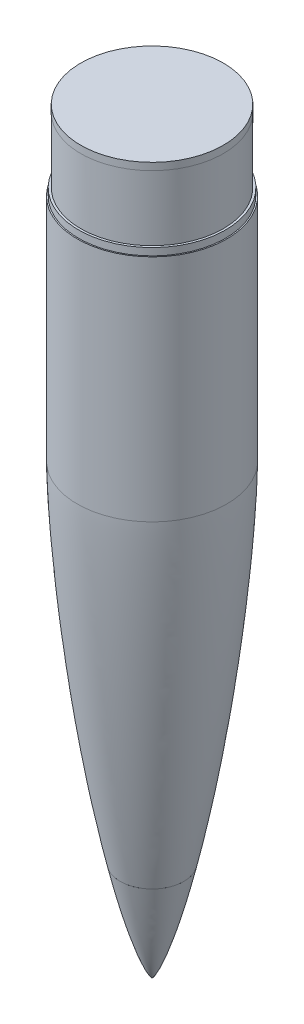
from build123d import *

# Parameters (mm, degrees)
SHELL3_T              = -3
REVOLVE10_START       = 309.892338598
REVOLVE10_OUTLINE_R   = 51.703475653
REVOLVE10_OUTLINE_R_2 = 49.33
REVOLVE10_DEPTH       = 158.88
SKETCH19_W            = 5
SKETCH19_H            = 49.34319438
SKETCH19_W_2          = 44.469592032
SKETCH19_H_2          = 5


# Read off the part's stored shape, not the designer's step: Revolve6, Revolve10, Revolve12
with BuildPart() as part:
    # Sketch1 → Revolve2 (revolve)
    with BuildSketch(Plane.YZ):
        with BuildLine():
            Line((68.892338598, 22.03669608), (68.892338598, 0))
            Line((68.892338598, 0), (309.892338598, 0))
            Line((309.892338598, 0), (309.892338598, 51.703475653))
            add(Edge.make_bspline(
                [(68.892338598, 22.036696078), (70.96416969, 22.497415108), (77.876502823, 24.010245465), (89.654701691, 26.457883592), (106.334645431, 29.655747436), (125.853639326, 33.065816617), (145.420783183, 36.187092783), (165.028645768, 39.040695578), (184.671859186, 41.639540014), (201.886997195, 43.696336538), (216.660371523, 45.304357577), (228.982426726, 46.53899565), (238.846350049, 47.46204834), (248.71628369, 48.318358048), (258.592017893, 49.104905531), (267.23821101, 49.728348294), (274.652658501, 50.212563982), (280.833617265, 50.579677684), (285.779727539, 50.849965544), (290.549374247, 51.086062909), (295.142398502, 51.288398084), (299.028855922, 51.436861373), (302.20824599, 51.540979), (304.858146787, 51.614171697), (306.713295392, 51.656552534), (308.236897063, 51.68463502), (309.230482405, 51.697083627), (309.693947311, 51.702090464), (309.892338598, 51.703475653)],
                knots=[0.230016032, 0.230016032, 0.230016032, 0.230016032, 0.230016032, 0.256872057, 0.319550184, 0.382228361, 0.444906455, 0.507584556, 0.570262684, 0.632940739, 0.695618764, 0.726957916, 0.758297067, 0.78963614, 0.820975213, 0.852314205, 0.883653198, 0.899322747, 0.914992297, 0.930661847, 0.946331397, 0.959748547, 0.973165698, 0.979874274, 0.986582849, 0.993291425, 0.996645712, 0.999156098, 0.999156098, 0.999156098, 0.999156098, 0.999156098], degree=4))
        make_face()
    revolve(axis=Axis((0, 0, 0), (0, 1, 0)))

    # Shell3
    shell3_openings = [part.faces().sort_by_distance(p)[0] for p in [
        (0, 309.892338598, 0),
        (0, 68.892338598, 0),
    ]]
    offset(amount=SHELL3_T, openings=shell3_openings, kind=Kind.INTERSECTION)

    # Sketch4 → Revolve5 (revolve)
    with BuildSketch(Plane(origin=(0, 0, 0), x_dir=(0, 1, 0), z_dir=(0, 0, 1)), mode=Mode.PRIVATE) as revolve5_sk:
        with BuildLine():
            add(Edge.make_bspline(
                [(118.892338598, 31.821069636), (118.193769239, 31.700420222), (112.61470459, 30.732647056), (102.165796478, 28.856499456), (89.654701691, 26.457883592), (77.876502823, 24.010245465), (70.96416969, 22.497415108), (68.892338598, 22.036696078)],
                knots=[0.607957601, 0.607957601, 0.607957601, 0.607957601, 0.607957601, 0.616927738, 0.679605914, 0.742284041, 0.769140067, 0.769140067, 0.769140067, 0.769140067, 0.769140067], degree=4))
            Line((68.892338598, 22.036696078), (68.892338598, 5.2))
            Line((68.892338598, 5.2), (83.892338598, 5.2))
            Line((83.892338598, 5.2), (118.892338598, 31.821069636))
        make_face()
    revolve(revolve5_sk.sketch.rotate(Axis((0, 0, 0), (0, 1, 0)), 90), axis=Axis((0, 0, 0), (0, 1, 0)))


with BuildPart() as body_2:
    # Sketch1<3> → Revolve3 (revolve)
    with BuildSketch(Plane.YZ):
        with BuildLine():
            add(Edge.make_bspline(
                [(0, 0), (0.001839143, 0.008888702), (0.007057294, 0.026188991), (0.022910311, 0.058976608), (0.056830094, 0.115635308), (0.108445486, 0.185649019), (0.191042047, 0.282917967), (0.316816673, 0.41262197), (0.508591814, 0.58839974), (0.830391435, 0.850120888), (1.372217083, 1.239564322), (2.325596475, 1.842085487), (4.024603962, 2.778864407), (6.971087135, 4.18782688), (11.987547002, 6.266678684), (20.509596689, 9.321209841), (33.015491366, 13.174452663), (46.931080328, 16.901757504), (58.537509164, 19.698426631), (66.128829141, 21.422166545), (68.892338598, 22.036696078)],
                knots=[0, 0, 0, 0, 0, 0.000114554, 0.000229109, 0.000458218, 0.000835627, 0.001213037, 0.001843102, 0.00274275, 0.0041256, 0.006458657, 0.010281417, 0.017005475, 0.028661401, 0.04776443, 0.078962988, 0.131516009, 0.194194154, 0.230016032, 0.230016032, 0.230016032, 0.230016032, 0.230016032], degree=4))
            Line((0, 0), (68.892338598, 0))
            Line((68.892338598, 0), (68.892338598, 22.03669608))
        make_face()
    revolve(axis=Axis((0, 0, 0), (0, 1, 0)))

    # Sketch6 → M10x1.5 Tapped Hole1 (revolve, cut)
    with BuildSketch(Plane(origin=(0, 68.892338598, 0), x_dir=(0, 0, 1), z_dir=(1, 0, 0))):
        Polygon((0, 0), (0, 27.053657631), (4.25, 24.5), (4.25, 0.775), (5.025, 0), align=None)
    revolve(axis=Axis((0, 75.242338598, 0), (0, -1, 0)), mode=Mode.SUBTRACT)


with BuildPart() as body_3:
    # Revolve6 outline → Revolve6 (revolve)
    with BuildSketch(Plane.XY):
        Polygon((50.68012246, 291.115771676), (49.33, 291.115771676), (49.33, 289.615771676), (50.854, 289.615771676), align=None)
    revolve(axis=Axis((0, 0, 0), (0, 1, 0)))


with BuildPart() as body_4:
    # Revolve6 2 outline → Revolve6 2 (revolve)
    with BuildSketch(Plane.XY):
        with BuildLine():
            Line((49.33, 302.762955592), (49.33, 391.215771676))
            Line((49.33, 391.215771676), (44.33, 391.215771676))
            Line((44.33, 391.215771676), (44.33, 269.615771676))
            Line((44.33, 269.615771676), (45.290467176, 251.112470655))
            add(Edge.make_bspline(
                [(48.503404584, 309.893796776), (48.501607518, 309.647322483), (48.498591794, 309.391933612), (48.492233128, 308.882202851), (48.48870164, 308.627899118), (48.476869482, 307.864628655), (48.467370215, 307.354464604), (48.435756692, 305.821248175), (48.41059902, 304.797655619), (48.325509692, 301.725239655), (48.25650989, 299.674249317), (48.022990749, 293.520023966), (47.832046231, 289.414629796), (47.182795728, 277.098702182), (46.648163913, 268.888283124), (45.799963937, 257.491621794), (45.550794374, 254.301693735), (45.290467176, 251.112470655)],
                knots=[0, 0, 0, 0, 0.00390625, 0.00390625, 0.0078125, 0.0078125, 0.015625, 0.015625, 0.03125, 0.03125, 0.0625, 0.0625, 0.125, 0.125, 0.25, 0.25, 0.298600031, 0.298600031, 0.298600031, 0.298600031], degree=3))
            Line((48.503404584, 309.893796776), (49.33, 302.762955592))
        make_face()
    revolve(axis=Axis((0, 0, 0), (0, 1, 0)))

    # Revolve10 outline → Revolve10 (add)
    with BuildSketch(Plane(origin=(0, 0, 0), x_dir=(1, 0, 0), z_dir=(0, 1, 0)).offset(REVOLVE10_START)):
        Circle(REVOLVE10_OUTLINE_R)
        Circle(REVOLVE10_OUTLINE_R_2, mode=Mode.SUBTRACT)
    extrude(amount=REVOLVE10_DEPTH)


with BuildPart() as body_5:
    # Sketch19 → Revolve11 (revolve)
    with BuildSketch(Plane(origin=(0, 0, 0), x_dir=(0, 1, 0), z_dir=(0, 0, 1)), mode=Mode.PRIVATE) as revolve11_sk:
        with Locations((521.276566922, 24.67159719)):
            Rectangle(SKETCH19_W, SKETCH19_H)
        with Locations((496.541770906, 41.59319438)):
            Rectangle(SKETCH19_W_2, SKETCH19_H_2)
    revolve(revolve11_sk.sketch.rotate(Axis((0, -29.806304847, 0), (0, 1, 0)), 270), axis=Axis((0, -29.806304847, 0), (0, 1, 0)))


with BuildPart() as body_6:
    # Revolve12 outline → Revolve12 (revolve)
    with BuildSketch(Plane.XY):
        Polygon((49.34319438, 518.776566922), (44.34319438, 518.776566922), (44.34319438, 468.772338598), (44.33, 391.215771676), (49.33, 391.215771676), (49.34319438, 468.772338598), (50.854, 468.772338598), (50.854, 473.772338598), (49.34319438, 473.772338598), align=None)
    revolve(axis=Axis((0, 0, 0), (0, 1, 0)))


solid = Compound([part.part, body_2.part, body_3.part, body_4.part, body_5.part, body_6.part])
